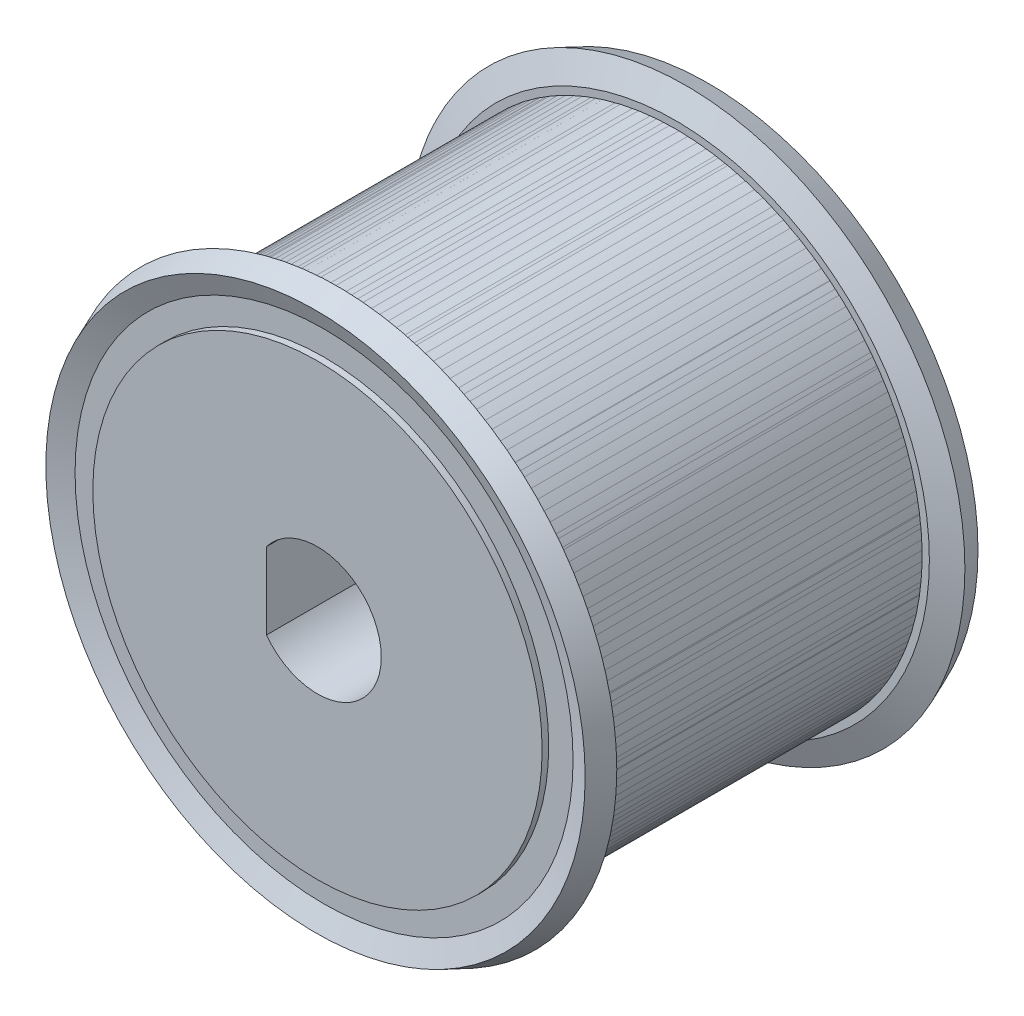
from build123d import *

# Parameters (mm, degrees)
TOOTHEXTRUDECUTGEARBELT01_DEPTH = 12.826999807
PATTERNGEARBELT01_COUNT         = 25
SKETCH_6_R                      = 14
CUT_EXTRUDE_3_DEPTH             = 15
CUT_EXTRUDE_4_DEPTH             = 35.647261803


with BuildPart() as part:
    # SketchRevolveGearBelt01 → GearBelt01 (revolve)
    with BuildSketch(Plane(origin=(0, 0, 0), x_dir=(0, 0, -1), z_dir=(1, 0, 0))):
        Polygon((15.239999771, 0), (15.239999771, 17.608359236), (14.724379779, 17.608359236), (14.724379779, 19.516946859), (15.395329714, 21.136763292), (13.642379193, 21.862859172), (12.826999807, 19.894359201), (12.826999807, 19.32285921), (-12.826999807, 19.32285921), (-12.826999807, 19.894359201), (-13.642379193, 21.862859172), (-15.395329714, 21.136763292), (-14.724379779, 19.516946859), (-14.724379779, 17.608359236), (-15.239999771, 17.608359236), (-15.239999771, 0), align=None)
    revolve(axis=Axis((0, 0, 0), (0, 0, -1)))

    # SketchToothGearBelt01 → ToothExtrudeCutGearBelt01 (cut, symmetric)
    with BuildSketch(Plane.XY):
        with BuildLine():
            ThreePointArc((19.201886784, 2.154858722), (19.322418901, 0), (19.201886784, -2.154858722))
            add(Edge.make_bspline(
                [(19.201886784, -2.154858722), (19.205063733, -2.126576118), (19.206246153, -2.083751453), (19.200652549, -2.02705595), (19.192903305, -1.985036503), (19.181654331, -1.943815793), (19.166985123, -1.903684756), (19.148999188, -1.864926633), (19.127823477, -1.827814976), (19.103607443, -1.792611714), (19.076522002, -1.759565311), (19.046758321, -1.728909001), (19.014526469, -1.700859172), (18.980053935, -1.675613721), (18.943584023, -1.653351122), (18.905374142, -1.634227399), (18.865693941, -1.618381647), (18.824823604, -1.605910325), (18.783051126, -1.596958846), (18.740673063, -1.591376199), (18.673469638, -1.589211633), (18.587331767, -1.591072547), (18.482164565, -1.587323262), (18.383173161, -1.575292014), (18.285413052, -1.555722701), (18.189491505, -1.528503358), (18.095996939, -1.493863666), (18.005504868, -1.452000012), (17.918571792, -1.40317437), (17.835732469, -1.347685868), (17.757496435, -1.285876138), (17.684344924, -1.218125284), (17.616727879, -1.144850065), (17.555061256, -1.066501192), (17.499724206, -0.98356059), (17.451057708, -0.896538423), (17.409358862, -0.805969981), (17.374892554, -0.71241229), (17.347839444, -0.616441044), (17.32848291, -0.518645741), (17.316505457, -0.419630986), (17.313024785, -0.299855766), (17.314484247, -0.160003622), (17.313927737, 0), (17.314484247, 0.160003622), (17.313024785, 0.299855766), (17.316505457, 0.419630986), (17.32848291, 0.518645741), (17.347839444, 0.616441044), (17.374892554, 0.71241229), (17.409358862, 0.805969981), (17.451057708, 0.896538423), (17.499724206, 0.98356059), (17.555061256, 1.066501192), (17.616727879, 1.144850065), (17.684344924, 1.218125284), (17.757496435, 1.285876138), (17.835732469, 1.347685868), (17.918571792, 1.40317437), (18.005504868, 1.452000012), (18.095996939, 1.493863666), (18.189491505, 1.528503358), (18.285413052, 1.555722701), (18.383173161, 1.575292014), (18.482164565, 1.587323262), (18.587331767, 1.591072547), (18.673469638, 1.589211633), (18.740673063, 1.591376199), (18.783051126, 1.596958846), (18.824823604, 1.605910325), (18.865693941, 1.618381647), (18.905374142, 1.634227399), (18.943584023, 1.653351122), (18.980053935, 1.675613721), (19.014526469, 1.700859172), (19.046758321, 1.728909001), (19.076522002, 1.759565311), (19.103607443, 1.792611714), (19.127823477, 1.827814976), (19.148999188, 1.864926633), (19.166985123, 1.903684756), (19.181654331, 1.943815793), (19.192903305, 1.985036503), (19.200652549, 2.02705595), (19.206246153, 2.083751453), (19.205063733, 2.126576118), (19.201886784, 2.154858722)],
                knots=[0, 0, 0, 0, 0.013004275, 0.019506413, 0.026008551, 0.032510688, 0.039012826, 0.045514963, 0.052017101, 0.058519239, 0.065021376, 0.071523514, 0.078025652, 0.084527789, 0.091029927, 0.097532065, 0.104034202, 0.11053634, 0.117038478, 0.123540615, 0.130042753, 0.147745131, 0.162920208, 0.178095285, 0.193270362, 0.208445439, 0.223620516, 0.238795593, 0.25397067, 0.269145747, 0.284320824, 0.299495901, 0.314670978, 0.329846055, 0.345021132, 0.360196209, 0.375371287, 0.390546364, 0.405721441, 0.420896518, 0.436071595, 0.451246672, 0.475623336, 0.5, 0.524376664, 0.548753328, 0.563928405, 0.579103482, 0.594278559, 0.609453636, 0.624628713, 0.639803791, 0.654978868, 0.670153945, 0.685329022, 0.700504099, 0.715679176, 0.730854253, 0.74602933, 0.761204407, 0.776379484, 0.791554561, 0.806729638, 0.821904715, 0.837079792, 0.852254869, 0.869957247, 0.876459385, 0.882961522, 0.88946366, 0.895965798, 0.902467935, 0.908970073, 0.915472211, 0.921974348, 0.928476486, 0.934978624, 0.941480761, 0.947982899, 0.954485037, 0.960987174, 0.967489312, 0.973991449, 0.980493587, 0.986995725, 1, 1, 1, 1], degree=3))
        make_face()
    toothextrudecutgearbelt01 = extrude(amount=TOOTHEXTRUDECUTGEARBELT01_DEPTH, both=True, mode=Mode.SUBTRACT)

    # PatternGearBelt01: ToothExtrudeCutGearBelt01 ×25 about axis
    patterngearbelt01_axis = Axis((0, 0, 55), (0, 0, -1))
    for i in range(1, PATTERNGEARBELT01_COUNT):
        add(toothextrudecutgearbelt01.rotate(patterngearbelt01_axis, i * 360 / PATTERNGEARBELT01_COUNT), mode=Mode.SUBTRACT)

    # 草图6 → 切除-拉伸3 (cut)
    with BuildSketch(Plane(origin=(0, 0, -15.239999771), x_dir=(-1, 0, 0), z_dir=(0, 0, -1))):
        Circle(SKETCH_6_R)
    extrude(amount=-CUT_EXTRUDE_3_DEPTH, mode=Mode.SUBTRACT)

    # 草图7 → 切除-拉伸4 (cut, through all)
    with BuildSketch(Plane(origin=(0, 0, -0.239999771), x_dir=(-1, 0, 0), z_dir=(0, 0, -1))):
        with BuildLine():
            Line((4, -3), (4, 3))
            ThreePointArc((4, 3), (-5, 0), (4, -3))
        make_face()
    extrude(amount=-CUT_EXTRUDE_4_DEPTH, mode=Mode.SUBTRACT)


solid = part.part
